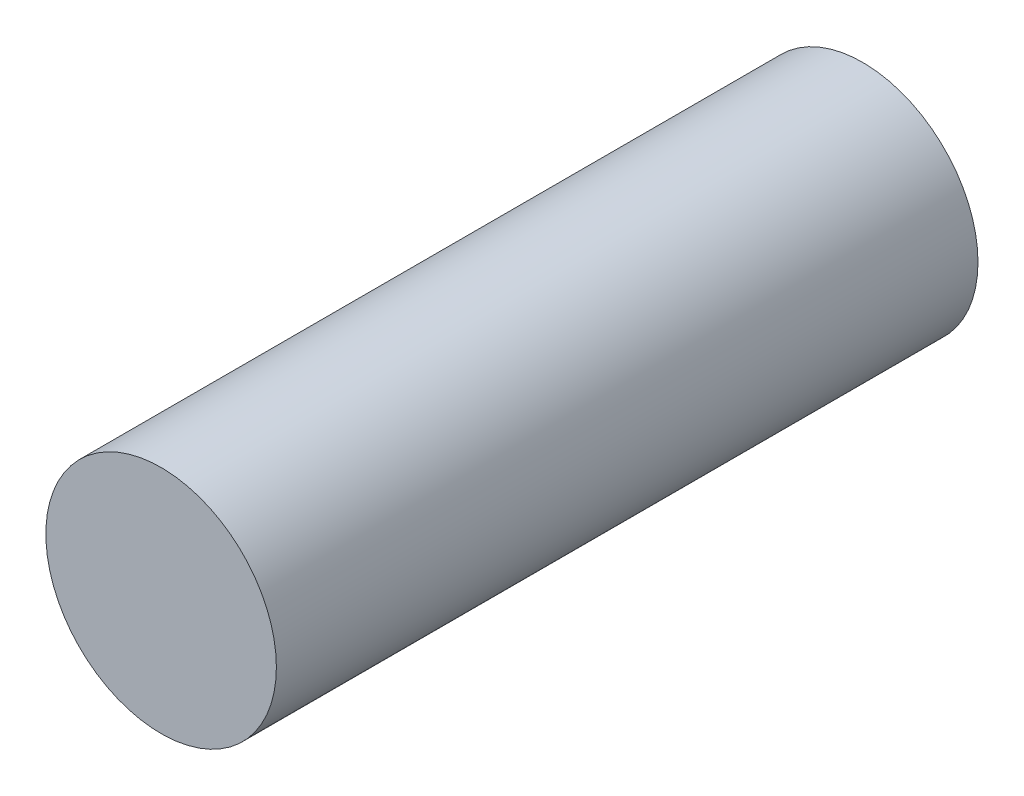
from build123d import *

# Parameters (mm, degrees)
SKETCH1_R           = 2.3
BOSS_EXTRUDE1_DEPTH = 14


with BuildPart() as part:
    # Sketch1 → Boss-Extrude1 (new body)
    with BuildSketch(Plane.XY):
        Circle(SKETCH1_R)
    extrude(amount=BOSS_EXTRUDE1_DEPTH)


solid = part.part
